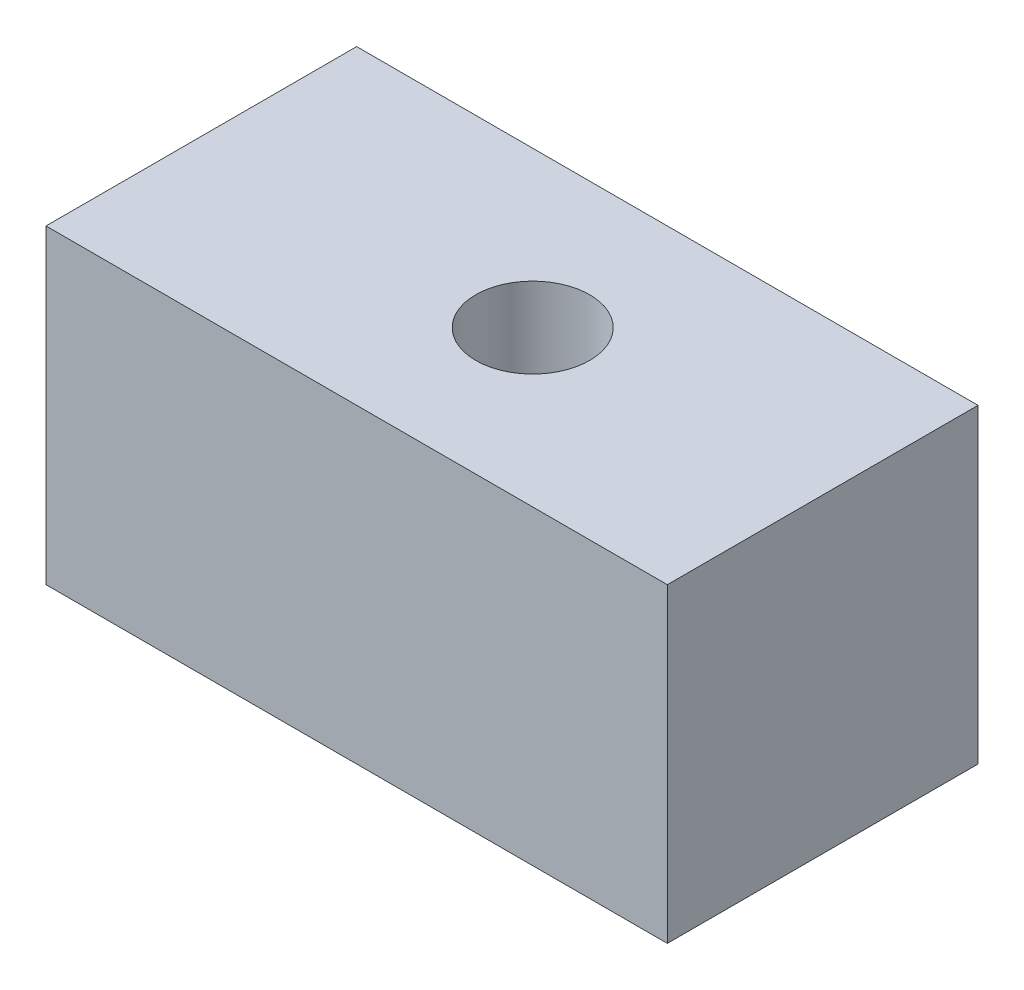
from build123d import *

# Parameters (mm, degrees)
SKETCH1_W           = 15
SKETCH1_H           = 15
BOSS_EXTRUDE1_DEPTH = 30
SKETCH2_R           = 2.75
CUT_EXTRUDE1_DEPTH  = 35.369317712
SKETCH3_W           = 10
SKETCH3_H           = 6.858
SKETCH3_R           = 1.5875
CUT_EXTRUDE2_DEPTH  = 1


with BuildPart() as part:
    # Sketch1 → Boss-Extrude1 (new body)
    with BuildSketch(Plane(origin=(0, 0, 0), x_dir=(0, 0, -1), z_dir=(1, 0, 0))):
        Rectangle(SKETCH1_W, SKETCH1_H)
    extrude(amount=BOSS_EXTRUDE1_DEPTH)

    # Sketch2 → Cut-Extrude1 (cut, through all)
    with BuildSketch(Plane(origin=(0, 7.5, 0), x_dir=(1, 0, 0), z_dir=(0, 1, 0))):
        with Locations((16, 0)):
            Circle(SKETCH2_R)
    extrude(amount=-CUT_EXTRUDE1_DEPTH, mode=Mode.SUBTRACT)

    # Sketch3 → Cut-Extrude2 (cut)
    with BuildSketch(Plane(origin=(0, 0, -7.5), x_dir=(-1, 0, 0), z_dir=(0, 0, -1))):
        with Locations((-5, 0.071)):
            Rectangle(SKETCH3_W, SKETCH3_H)
        with Locations((-4.92, 0.071)):
            Circle(SKETCH3_R, mode=Mode.SUBTRACT)
    extrude(amount=-CUT_EXTRUDE2_DEPTH, mode=Mode.SUBTRACT)


solid = part.part
